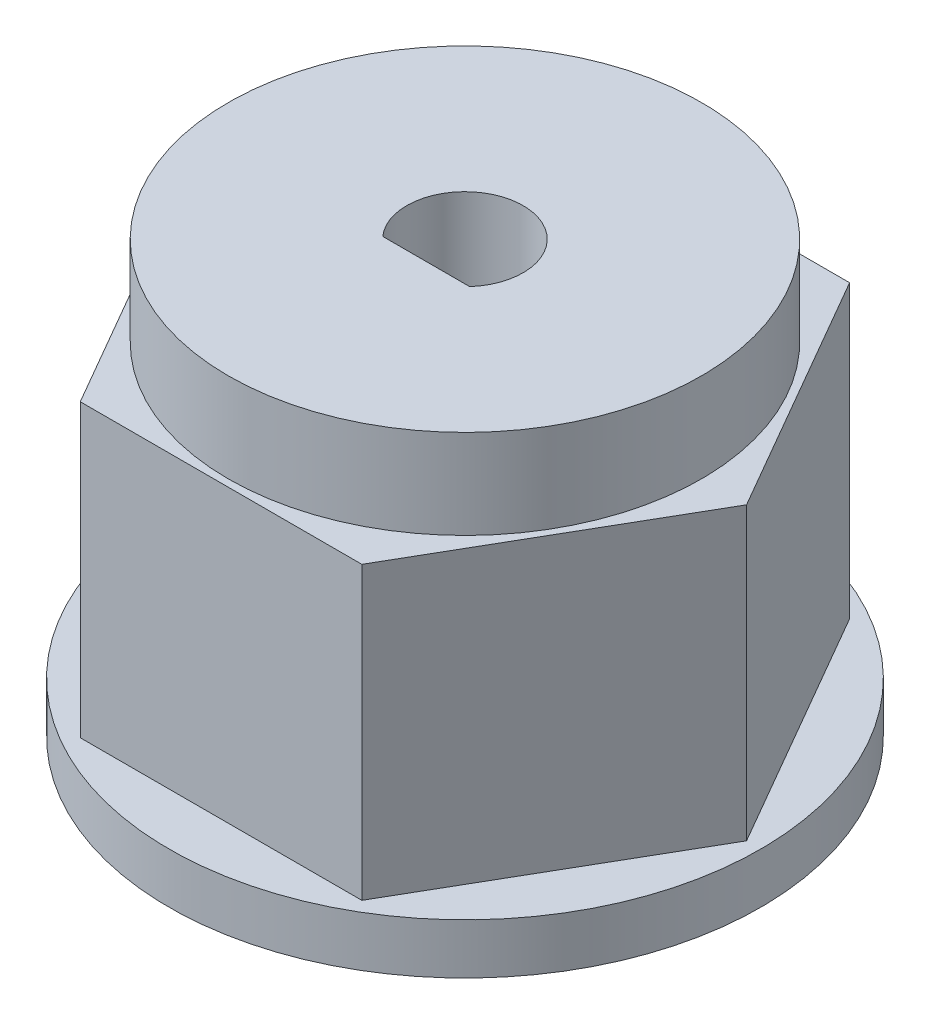
from build123d import *

# Parameters (mm, degrees)
BOSS_EXTRUDE1_DEPTH = 7.5
SKETCH2_R           = 6.1
BOSS_EXTRUDE2_DEPTH = 2.3
SKETCH3_R           = 7.625
BOSS_EXTRUDE3_DEPTH = 1.3
CUT_EXTRUDE1_DEPTH  = 16.475504838


with BuildPart() as part:
    # Sketch1 → Boss-Extrude1 (new body)
    with BuildSketch(Plane(origin=(0, 0, 0), x_dir=(1, 0, 0), z_dir=(0, 1, 0))):
        Polygon((7.257292884, 0), (3.628646442, 6.285), (-3.628646442, 6.285), (-7.257292884, 0), (-3.628646442, -6.285), (3.628646442, -6.285), align=None)
    extrude(amount=BOSS_EXTRUDE1_DEPTH)

    # Sketch2 → Boss-Extrude2 (add)
    with BuildSketch(Plane(origin=(0, 7.5, 0), x_dir=(1, 0, 0), z_dir=(0, 1, 0))):
        Circle(SKETCH2_R)
    extrude(amount=BOSS_EXTRUDE2_DEPTH)

    # Sketch3 → Boss-Extrude3 (add)
    with BuildSketch(Plane.XZ):
        Circle(SKETCH3_R)
    extrude(amount=BOSS_EXTRUDE3_DEPTH)

    # Sketch4 → Cut-Extrude1 (cut, through all)
    with BuildSketch(Plane(origin=(0, 9.8, 0), x_dir=(1, 0, 0), z_dir=(0, 1, 0))):
        with BuildLine():
            Line((-1.12, -0.997797575), (1.12, -0.997797575))
            ThreePointArc((1.12, -0.997797575), (0, 1.5), (-1.12, -0.997797575))
        make_face()
    extrude(amount=-CUT_EXTRUDE1_DEPTH, mode=Mode.SUBTRACT)


solid = part.part
